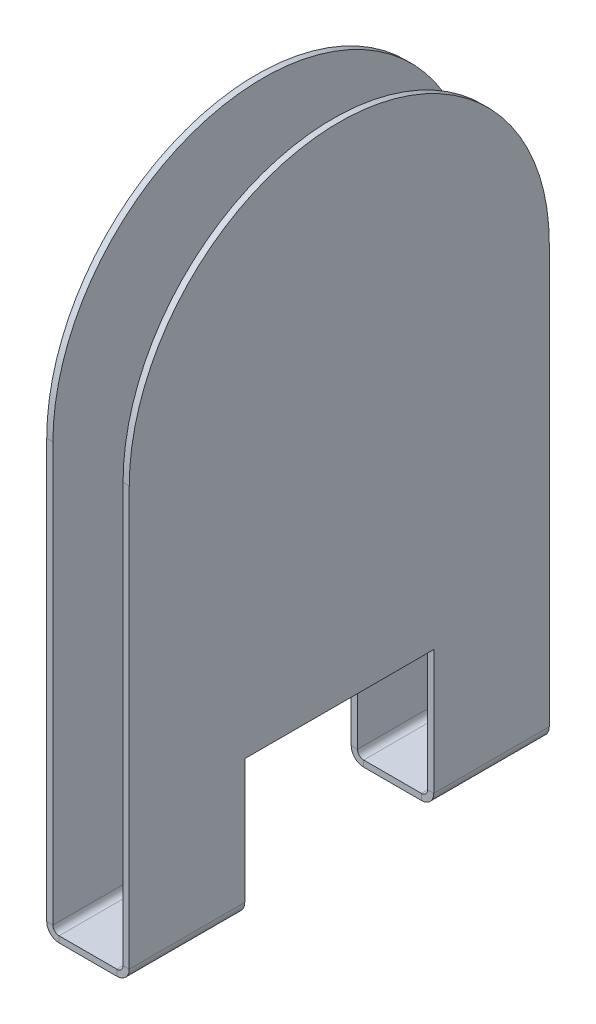
from build123d import *

# Parameters (mm, degrees)
SKETCH2_W                  = 40
SKETCH2_H                  = 22.5
BASE_FLANGE1_DEPTH         = 0.7366
SKETCHED_START             = -25
SKETCHED_BEND1_DEPTH       = 50
SKETCHED_BEND1_2_DEPTH     = 13.75
SKETCHED_START_2           = 11.25
SKETCHED_BEND1_3_DEPTH     = 13.75
SKETCHED_START_3           = -26
SKETCHED_BEND1_4_OUTLINE_W = 0.7366
SKETCHED_BEND1_4_OUTLINE_H = 50
SKETCHED_BEND1_4_DEPTH     = 61
SKETCHED_START_4           = 75
SKETCHED_BEND1_5_OUTLINE_W = 0.7366
SKETCHED_BEND1_5_OUTLINE_H = 50
SKETCHED_BEND1_5_DEPTH     = 61
SKETCHED_START_5           = 50.0884
SKETCHED_BEND1_6_DEPTH     = 0.7366
SKETCHED_START_6           = 59.175
SKETCHED_BEND1_7_DEPTH     = 0.7366


with BuildPart() as part:
    # Base-Flange1: sheet metal written as solids
    # Sketch2 → Base-Flange1 (new body)
    with BuildSketch(Plane(origin=(0, 0, 0), x_dir=(1, 0, 0), z_dir=(0, 1, 0))):
        with BuildLine():
            Line((0, 25), (110, 25))
            ThreePointArc((110, 25), (135, 0), (110, -25))
            Line((110, -25), (0, -25))
            ThreePointArc((0, -25), (-25, 0), (0, 25))
        make_face()
        with Locations((55, 0)):
            Rectangle(SKETCH2_W, SKETCH2_H, mode=Mode.SUBTRACT)
    extrude(amount=-BASE_FLANGE1_DEPTH)

    # Sketched Bend1: read off the stored shape, not the designer's step
    # Sketched Bend1 outline → Sketched Bend1 (cut)
    with BuildSketch(Plane.XY.offset(SKETCHED_START)):
        with BuildLine():
            Line((35, -0.7366), (51.5616, -0.7366))
            ThreePointArc((51.5616, -0.7366), (50.825, -0.539228625), (50.285771375, 0))
            Line((50.285771375, 0), (35, 0))
            Line((35, 0), (35, -0.7366))
        make_face()
        with BuildLine():
            ThreePointArc((59.714228625, 0), (59.175, -0.539228625), (58.4384, -0.7366))
            Line((58.4384, -0.7366), (75, -0.7366))
            Line((75, -0.7366), (75, 0))
            Line((75, 0), (59.714228625, 0))
        make_face()
    extrude(amount=SKETCHED_BEND1_DEPTH, mode=Mode.SUBTRACT)

    # Sketched Bend1 2 outline → Sketched Bend1 2 (add)
    with BuildSketch(Plane.XY.offset(SKETCHED_START)):
        with BuildLine():
            ThreePointArc((50.0884, 0.7366), (50.138598073, 0.355307783), (50.285771375, 0))
            Line((50.285771375, 0), (51.5616, 0))
            ThreePointArc((51.5616, 0), (51.040745145, 0.215745145), (50.825, 0.7366))
            Line((50.825, 0.7366), (50.825, 15.562627139))
            Line((50.825, 15.562627139), (50.0884, 15.562627139))
            Line((50.0884, 15.562627139), (50.0884, 0.7366))
        make_face()
        with BuildLine():
            Line((58.4384, 0), (59.714228625, 0))
            ThreePointArc((59.714228625, 0), (59.861401927, 0.355307783), (59.9116, 0.7366))
            Line((59.9116, 0.7366), (59.9116, 15.562627139))
            Line((59.9116, 15.562627139), (59.175, 15.562627139))
            Line((59.175, 15.562627139), (59.175, 0.7366))
            ThreePointArc((59.175, 0.7366), (58.959254855, 0.215745145), (58.4384, 0))
        make_face()
    extrude(amount=SKETCHED_BEND1_2_DEPTH)

    # Sketched Bend1 3 outline → Sketched Bend1 3 (add)
    with BuildSketch(Plane.XY.offset(SKETCHED_START_2)):
        with BuildLine():
            ThreePointArc((50.0884, 0.7366), (50.138598073, 0.355307783), (50.285771375, 0))
            Line((50.285771375, 0), (51.5616, 0))
            ThreePointArc((51.5616, 0), (51.040745145, 0.215745145), (50.825, 0.7366))
            Line((50.825, 0.7366), (50.825, 15.562627139))
            Line((50.825, 15.562627139), (50.0884, 15.562627139))
            Line((50.0884, 15.562627139), (50.0884, 0.7366))
        make_face()
        with BuildLine():
            Line((58.4384, 0), (59.714228625, 0))
            ThreePointArc((59.714228625, 0), (59.861401927, 0.355307783), (59.9116, 0.7366))
            Line((59.9116, 0.7366), (59.9116, 15.562627139))
            Line((59.9116, 15.562627139), (59.175, 15.562627139))
            Line((59.175, 15.562627139), (59.175, 0.7366))
            ThreePointArc((59.175, 0.7366), (58.959254855, 0.215745145), (58.4384, 0))
        make_face()
    extrude(amount=SKETCHED_BEND1_3_DEPTH)

    # Sketched Bend1 4 outline → Sketched Bend1 4 (cut)
    with BuildSketch(Plane.YZ.offset(SKETCHED_START_3)):
        with Locations((-0.3683, 0)):
            Rectangle(SKETCHED_BEND1_4_OUTLINE_W, SKETCHED_BEND1_4_OUTLINE_H)
    extrude(amount=SKETCHED_BEND1_4_DEPTH, mode=Mode.SUBTRACT)

    # Sketched Bend1 5 outline → Sketched Bend1 5 (cut)
    with BuildSketch(Plane.YZ.offset(SKETCHED_START_4)):
        with Locations((-0.3683, 0)):
            Rectangle(SKETCHED_BEND1_5_OUTLINE_W, SKETCHED_BEND1_5_OUTLINE_H)
    extrude(amount=SKETCHED_BEND1_5_DEPTH, mode=Mode.SUBTRACT)

    # Sketched Bend1 6 outline → Sketched Bend1 6 (add)
    with BuildSketch(Plane.YZ.offset(SKETCHED_START_5)):
        with BuildLine():
            ThreePointArc((50.562627139, -25), (75.562627139, 0), (50.562627139, 25))
            Line((50.562627139, 25), (15.562627139, 25))
            Line((15.562627139, 25), (15.562627139, -25))
            Line((15.562627139, -25), (50.562627139, -25))
        make_face()
    extrude(amount=SKETCHED_BEND1_6_DEPTH)

    # Sketched Bend1 7 outline → Sketched Bend1 7 (add)
    with BuildSketch(Plane.YZ.offset(SKETCHED_START_6)):
        with BuildLine():
            ThreePointArc((50.562627139, -25), (75.562627139, 0), (50.562627139, 25))
            Line((50.562627139, 25), (15.562627139, 25))
            Line((15.562627139, 25), (15.562627139, -25))
            Line((15.562627139, -25), (50.562627139, -25))
        make_face()
    extrude(amount=SKETCHED_BEND1_7_DEPTH)


solid = part.part
